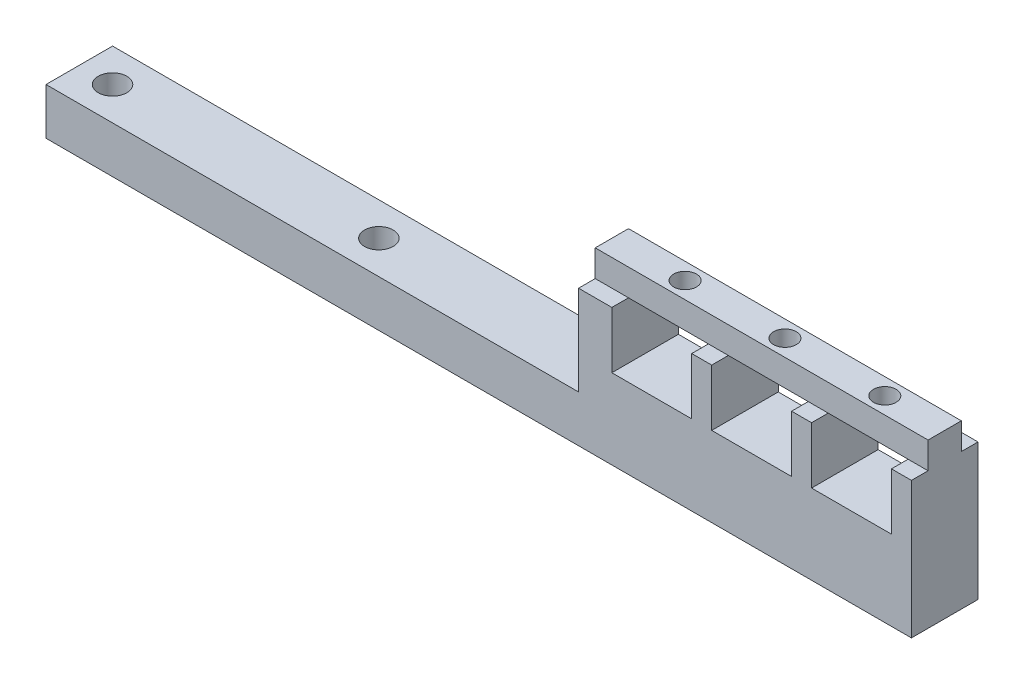
from build123d import *

# Parameters (mm, degrees)
SKETCH1_W           = 130
SKETCH1_H           = 10
SKETCH1_R           = 2.15
BOSS_EXTRUDE1_DEPTH = 7
SKETCH3_W           = 50
SKETCH3_H           = 10
BOSS_EXTRUDE2_DEPTH = 38.5
SKETCH9_W           = 10
SKETCH9_H           = 21
CUT_EXTRUDE5_DEPTH  = 139.095075944
SKETCH12_W          = 50
SKETCH12_H          = 4
CUT_EXTRUDE6_DEPTH  = 2.5
SKETCH13_W          = 50
SKETCH13_H          = 4
CUT_EXTRUDE7_DEPTH  = 2.5
SKETCH14_W          = 12
SKETCH14_H          = 8.5
CUT_EXTRUDE9_DEPTH  = 133.665933834
SKETCH15_R          = 1.7
CUT_EXTRUDE10_DEPTH = 132.98579469


with BuildPart() as part:
    # Sketch1 → Boss-Extrude1 (new body)
    with BuildSketch(Plane(origin=(0, 0, 0), x_dir=(1, 0, 0), z_dir=(0, 1, 0))):
        with Locations((65, -5)):
            Rectangle(SKETCH1_W, SKETCH1_H)
        with Locations((5, -5)):
            Circle(SKETCH1_R, mode=Mode.SUBTRACT)
        with Locations((45, -5)):
            Circle(SKETCH1_R, mode=Mode.SUBTRACT)
    extrude(amount=BOSS_EXTRUDE1_DEPTH)

    # Sketch3 → Boss-Extrude2 (add)
    with BuildSketch(Plane(origin=(0, 7, 0), x_dir=(1, 0, 0), z_dir=(0, 1, 0))):
        with Locations((105, -5)):
            Rectangle(SKETCH3_W, SKETCH3_H)
    extrude(amount=BOSS_EXTRUDE2_DEPTH)

    # Sketch9 → Cut-Extrude5 (cut, through all)
    with BuildSketch(Plane(origin=(130, 0, 0), x_dir=(0, 0, -1), z_dir=(1, 0, 0))):
        with Locations((-5, 35)):
            Rectangle(SKETCH9_W, SKETCH9_H)
    extrude(amount=-CUT_EXTRUDE5_DEPTH, mode=Mode.SUBTRACT)

    # Sketch12 → Cut-Extrude6 (cut)
    with BuildSketch(Plane.XY.offset(10)):
        with Locations((105, 22.5)):
            Rectangle(SKETCH12_W, SKETCH12_H)
    extrude(amount=-CUT_EXTRUDE6_DEPTH, mode=Mode.SUBTRACT)

    # Sketch13 → Cut-Extrude7 (cut)
    with BuildSketch(Plane(origin=(0, 0, 0), x_dir=(-1, 0, 0), z_dir=(0, 0, -1))):
        with Locations((-105, 22.5)):
            Rectangle(SKETCH13_W, SKETCH13_H)
    extrude(amount=-CUT_EXTRUDE7_DEPTH, mode=Mode.SUBTRACT)

    # Sketch14 → Cut-Extrude9 (cut, through all)
    with BuildSketch(Plane.XY.offset(10)):
        with Locations((121, 16.25)):
            Rectangle(SKETCH14_W, SKETCH14_H)
        with Locations((91, 16.25)):
            Rectangle(SKETCH14_W, SKETCH14_H)
        with Locations((106, 16.25)):
            Rectangle(SKETCH14_W, SKETCH14_H)
    extrude(amount=-CUT_EXTRUDE9_DEPTH, mode=Mode.SUBTRACT)

    # Sketch15 → Cut-Extrude10 (cut, through all)
    with BuildSketch(Plane(origin=(0, 20.5, 0), x_dir=(-1, 0, 0), z_dir=(0, -1, 0))):
        with Locations((-121, -5)):
            Circle(SKETCH15_R)
        with Locations((-106, -5)):
            Circle(SKETCH15_R)
        with Locations((-91, -5)):
            Circle(SKETCH15_R)
    extrude(amount=-CUT_EXTRUDE10_DEPTH, mode=Mode.SUBTRACT)


solid = part.part
